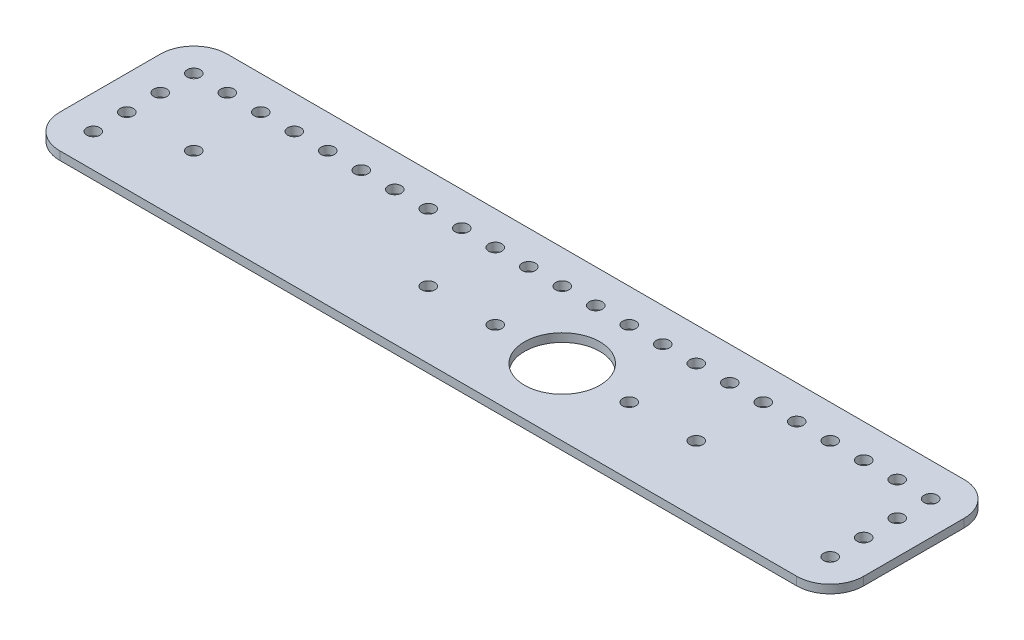
from build123d import *

# Parameters (mm, degrees)
SKETCH1_W           = 304.8
SKETCH1_H           = 63.5
SKETCH1_R           = 2.4892
BOSS_EXTRUDE1_DEPTH = 3.175
SKETCH3_R           = 2.4892
SKETCH3_R_2         = 14.2875
CUT_EXTRUDE1_DEPTH  = 312.36051552
FILLET1_R           = 12.7


with BuildPart() as part:
    # Sketch1 → Boss-Extrude1 (new body)
    with BuildSketch(Plane(origin=(0, 0, 0), x_dir=(1, 0, 0), z_dir=(0, 1, 0))):
        with Locations((152.4, 31.75)):
            Rectangle(SKETCH1_W, SKETCH1_H)
        with Locations((12.7, 12.7)):
            Circle(SKETCH1_R, mode=Mode.SUBTRACT)
        with Locations((12.7, 25.4)):
            Circle(SKETCH1_R, mode=Mode.SUBTRACT)
        with Locations((292.1, 12.7)):
            Circle(SKETCH1_R, mode=Mode.SUBTRACT)
        with Locations((292.1, 25.4)):
            Circle(SKETCH1_R, mode=Mode.SUBTRACT)
        with Locations((12.7, 38.1)):
            Circle(SKETCH1_R, mode=Mode.SUBTRACT)
        with Locations((12.7, 50.8)):
            Circle(SKETCH1_R, mode=Mode.SUBTRACT)
        with Locations((25.4, 50.8)):
            Circle(SKETCH1_R, mode=Mode.SUBTRACT)
        with Locations((38.1, 50.8)):
            Circle(SKETCH1_R, mode=Mode.SUBTRACT)
        with Locations((50.8, 50.8)):
            Circle(SKETCH1_R, mode=Mode.SUBTRACT)
        with Locations((63.5, 50.8)):
            Circle(SKETCH1_R, mode=Mode.SUBTRACT)
        with Locations((76.2, 50.8)):
            Circle(SKETCH1_R, mode=Mode.SUBTRACT)
        with Locations((88.9, 50.8)):
            Circle(SKETCH1_R, mode=Mode.SUBTRACT)
        with Locations((101.6, 50.8)):
            Circle(SKETCH1_R, mode=Mode.SUBTRACT)
        with Locations((114.3, 50.8)):
            Circle(SKETCH1_R, mode=Mode.SUBTRACT)
        with Locations((127, 50.8)):
            Circle(SKETCH1_R, mode=Mode.SUBTRACT)
        with Locations((139.7, 50.8)):
            Circle(SKETCH1_R, mode=Mode.SUBTRACT)
        with Locations((152.4, 50.8)):
            Circle(SKETCH1_R, mode=Mode.SUBTRACT)
        with Locations((292.1, 38.1)):
            Circle(SKETCH1_R, mode=Mode.SUBTRACT)
        with Locations((165.1, 50.8)):
            Circle(SKETCH1_R, mode=Mode.SUBTRACT)
        with Locations((177.8, 50.8)):
            Circle(SKETCH1_R, mode=Mode.SUBTRACT)
        with Locations((190.5, 50.8)):
            Circle(SKETCH1_R, mode=Mode.SUBTRACT)
        with Locations((203.2, 50.8)):
            Circle(SKETCH1_R, mode=Mode.SUBTRACT)
        with Locations((215.9, 50.8)):
            Circle(SKETCH1_R, mode=Mode.SUBTRACT)
        with Locations((228.6, 50.8)):
            Circle(SKETCH1_R, mode=Mode.SUBTRACT)
        with Locations((241.3, 50.8)):
            Circle(SKETCH1_R, mode=Mode.SUBTRACT)
        with Locations((254, 50.8)):
            Circle(SKETCH1_R, mode=Mode.SUBTRACT)
        with Locations((266.7, 50.8)):
            Circle(SKETCH1_R, mode=Mode.SUBTRACT)
        with Locations((279.4, 50.8)):
            Circle(SKETCH1_R, mode=Mode.SUBTRACT)
        with Locations((292.1, 50.8)):
            Circle(SKETCH1_R, mode=Mode.SUBTRACT)
    extrude(amount=BOSS_EXTRUDE1_DEPTH)

    # Sketch3 → Cut-Extrude1 (cut, through all)
    with BuildSketch(Plane(origin=(0, 3.175, 0), x_dir=(1, 0, 0), z_dir=(0, 1, 0))):
        with Locations((126.98924183, 25.4)):
            Circle(SKETCH3_R)
        with Locations((177.78924183, 25.4)):
            Circle(SKETCH3_R_2)
        with Locations((228.58924183, 25.4)):
            Circle(SKETCH3_R)
        with Locations((38.08924183, 25.4)):
            Circle(SKETCH3_R)
        with Locations((152.38924183, 25.4)):
            Circle(SKETCH3_R)
        with Locations((203.18924183, 25.4)):
            Circle(SKETCH3_R)
    extrude(amount=-CUT_EXTRUDE1_DEPTH, mode=Mode.SUBTRACT)

    # Fillet1
    fillet1_edges = [part.edges().sort_by_distance(p)[0] for p in [
        (0, 1.5875, -63.5),
        (304.8, 1.5875, -63.5),
        (304.8, 1.5875, 0),
        (0, 1.5875, 0),
    ]]
    fillet(fillet1_edges, radius=FILLET1_R)


solid = part.part
